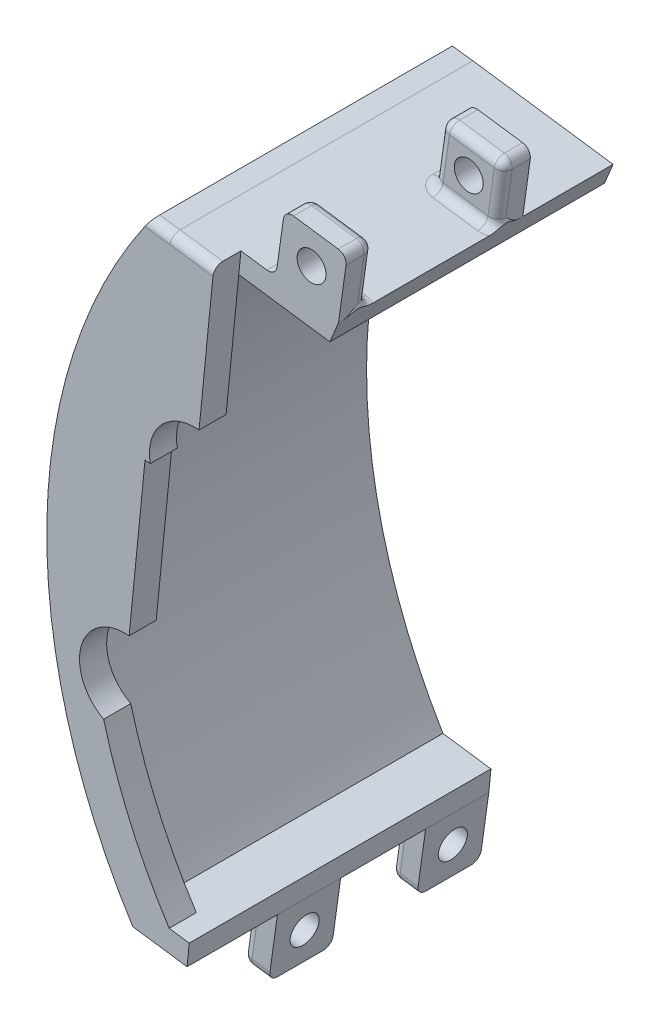
from build123d import *

# Parameters (mm, degrees)
SKETCH1_R                = 4.445
BOSS_EXTRUDE2_DEPTH      = 8.128
BOSS_EXTRUDE3_DEPTH      = 30.48
CUT_EXTRUDE1_START       = -38.608
CUT_EXTRUDE1_OUTLINE_R   = 4.445
CUT_EXTRUDE1_DEPTH       = 38.608
BOSS_EXTRUDE13_DEPTH     = 3.81
BOSS_EXTRUDE14_DEPTH     = 8.128
BOSS_EXTRUDE15_OUTLINE_W = 8.89
BOSS_EXTRUDE15_OUTLINE_H = 3.81
BOSS_EXTRUDE15_DEPTH     = 8.89
SKETCH10_W               = 3.81
SKETCH10_H               = 8.89
BOSS_EXTRUDE16_DEPTH     = 8.89
SKETCH11_R               = 2.032
CUT_EXTRUDE3_DEPTH       = 453.756346398
SKETCH12_R               = 2.032
CUT_EXTRUDE4_DEPTH       = 167.419125065
FILLET1_R                = 1.27
FILLET2_R                = 1.27
FILLET3_R                = 1.27


# Read off the part's stored shape, not the designer's step: Cut-Extrude1, Boss-Extrude15
with BuildPart() as part:
    # Sketch1 → Boss-Extrude2 (new body)
    with BuildSketch(Plane.XY):
        with BuildLine():
            Line((422.721831239, -137.260955008), (397.142573767, -117.628068619))
            Line((397.142573767, -117.628068619), (377.42339183, -114.876256201))
            Line((377.42339183, -114.876256201), (374.540581179, -114.51871973))
            ThreePointArc((374.540581179, -114.51871973), (359.974116362, -157.771470169), (372.030446696, -201.789957384))
            Line((372.030446696, -201.789957384), (375.362354889, -202.25020442))
            Line((375.362354889, -202.25020442), (407.292032563, -206.705991877))
            Line((407.292032563, -206.705991877), (428.301760664, -185.691281663))
            ThreePointArc((428.301760664, -185.691281663), (410.835199313, -163.167091308), (422.721831239, -137.260955008))
        make_face()
        with Locations((413.081283236, -189.895733265)):
            Circle(SKETCH1_R, mode=Mode.SUBTRACT)
        with BuildLine():
            Line((375.438501949, -117.676800355), (395.924761017, -120.535658409))
            Line((395.924761017, -120.535658409), (403.250926595, -126.158721416))
            Line((403.250926595, -126.158721416), (396.525446728, -140.500644454))
            ThreePointArc((396.525446728, -140.500644454), (394.840250533, -144.59682662), (393.557057048, -148.836167256))
            Line((393.557057048, -148.836167256), (408.135947471, -152.492527686))
            ThreePointArc((408.135947471, -152.492527686), (407.478732389, -164.116282679), (411.163311063, -175.160172021))
            Line((411.163311063, -175.160172021), (398.054918567, -182.514290852))
            ThreePointArc((398.054918567, -182.514290852), (404.027476783, -190.830097132), (411.692336104, -197.617881552))
            ThreePointArc((411.692336104, -197.617881552), (411.8058947, -197.693319009), (411.923337289, -197.76255486))
            Line((411.923337289, -197.76255486), (406.209814322, -203.477432695))
            Line((406.209814322, -203.477432695), (373.21862712, -198.873511552))
            ThreePointArc((373.21862712, -198.873511552), (362.510049562, -157.95204405), (375.438501949, -117.676800355))
        make_face(mode=Mode.SUBTRACT)
        with Locations((404.375009271, -140.520000011)):
            Circle(SKETCH1_R, mode=Mode.SUBTRACT)
    extrude(amount=BOSS_EXTRUDE2_DEPTH)


with BuildPart() as body_2:
    # Sketch2 → Boss-Extrude3 (new body)
    with BuildSketch(Plane.XY.offset(8.128)):
        with BuildLine():
            Line((397.142573767, -117.628068619), (377.42339183, -114.876256201))
            Line((377.42339183, -114.876256201), (374.540581179, -114.51871973))
            ThreePointArc((374.540581179, -114.51871973), (359.974116362, -157.771470169), (372.030446696, -201.789957384))
            Line((372.030446696, -201.789957384), (375.362354889, -202.25020442))
            Line((375.362354889, -202.25020442), (407.292032563, -206.705991877))
            Line((407.292032563, -206.705991877), (414.532433241, -199.463874257))
            ThreePointArc((414.532433241, -199.463874257), (409.852770309, -196.253623443), (405.604270928, -192.491282623))
            ThreePointArc((405.604270928, -192.491282623), (405.997230199, -190.639893213), (406.27151817, -188.767241124))
            ThreePointArc((406.27151817, -188.767241124), (395.867947628, -167.427396522), (398.397521154, -143.821793259))
            ThreePointArc((398.397521154, -143.821793259), (398.461114435, -137.105611235), (404.245702044, -133.692446827))
            ThreePointArc((404.245702044, -133.692446827), (407.006708255, -130.47787998), (410.071206758, -127.551201961))
            Line((410.071206758, -127.551201961), (397.142573767, -117.628068619))
        make_face()
        with BuildLine():
            ThreePointArc((403.061727172, -189.725585097), (401.059193553, -196.35778198), (397.415632908, -202.25020442))
            Line((397.415632908, -202.25020442), (373.21862712, -198.873511552))
            ThreePointArc((373.21862712, -198.873511552), (362.510049562, -157.95204405), (375.438501949, -117.676800355))
            Line((375.438501949, -117.676800355), (395.924761017, -120.535658409))
            Line((395.924761017, -120.535658409), (400.202083686, -123.818638382))
            ThreePointArc((400.202083686, -123.818638382), (401.150247915, -126.46196405), (401.831128402, -129.1864067))
            Line((401.831128402, -129.1864067), (400.808060919, -131.368073344))
            ThreePointArc((400.808060919, -131.368073344), (395.439235277, -136.441663908), (395.124115066, -143.821793259))
            ThreePointArc((395.124115066, -143.821793259), (392.848289911, -167.853501069), (403.061727172, -189.725585097))
        make_face(mode=Mode.SUBTRACT)
    extrude(amount=BOSS_EXTRUDE3_DEPTH)


with BuildPart() as cut_extrude1_tool:
    # Cut-Extrude1 outline → Cut-Extrude1 (new body)
    with BuildSketch(Plane.XY.offset(38.608).offset(CUT_EXTRUDE1_START)):
        with BuildLine():
            Line((397.142573767, -117.628068619), (395.924761017, -120.535658409))
            Line((395.924761017, -120.535658409), (400.202083686, -123.818638382))
            ThreePointArc((400.202083686, -123.818638382), (401.150247915, -126.46196405), (401.831128402, -129.1864067))
            Line((401.831128402, -129.1864067), (400.808060919, -131.368073344))
            ThreePointArc((400.808060919, -131.368073344), (395.439235277, -136.441663908), (395.124115066, -143.821793259))
            ThreePointArc((395.124115066, -143.821793259), (394.268902285, -146.306578133), (393.557057048, -148.836167256))
            ThreePointArc((393.557057048, -148.836167256), (392.580609278, -166.105992541), (398.054918568, -182.514290852))
            ThreePointArc((398.054918568, -182.514290852), (400.385798954, -186.239721497), (403.061727172, -189.725585097))
            ThreePointArc((403.061727172, -189.725585097), (401.059193553, -196.35778198), (397.415632908, -202.25020442))
            Line((397.415632908, -202.25020442), (379.967554953, -199.815324629))
            Line((379.967554953, -199.815324629), (379.666531571, -202.850852403))
            Line((379.666531571, -202.850852403), (407.292032563, -206.705991877))
            Line((407.292032563, -206.705991877), (428.301760664, -185.691281663))
            ThreePointArc((428.301760664, -185.691281663), (410.835199313, -163.167091308), (422.721831239, -137.260955008))
            Line((422.721831239, -137.260955008), (397.142573767, -117.628068619))
        make_face()
        with BuildLine():
            Line((411.923337289, -197.76255486), (411.913410508, -197.772483995))
            ThreePointArc((411.913410508, -197.772483995), (411.802759907, -197.695344929), (411.692336104, -197.617881552))
            ThreePointArc((411.692336104, -197.617881552), (411.8058947, -197.693319009), (411.923337289, -197.76255486))
        make_face(mode=Mode.SUBTRACT)
        with BuildLine():
            Line((411.163311063, -175.160172021), (400.71315601, -181.022956652))
            ThreePointArc((400.71315601, -181.022956652), (395.601784353, -165.702501323), (396.513495254, -149.57763683))
            Line((396.513495254, -149.57763683), (408.135947471, -152.492527686))
            ThreePointArc((408.135947471, -152.492527686), (407.478732389, -164.116282679), (411.163311063, -175.160172021))
        make_face(mode=Mode.SUBTRACT)
        with Locations((404.375009271, -140.520000011)):
            Circle(CUT_EXTRUDE1_OUTLINE_R, mode=Mode.SUBTRACT)
        with Locations((413.081283236, -189.895733265)):
            Circle(CUT_EXTRUDE1_OUTLINE_R, mode=Mode.SUBTRACT)
    extrude(amount=CUT_EXTRUDE1_DEPTH)


with BuildPart() as part_1:
    add(part.part)

    # Cut-Extrude1: cut by cut_extrude1_tool
    add(cut_extrude1_tool.part, mode=Mode.SUBTRACT)



with BuildPart() as body_2_1:
    add(body_2.part)

    # Cut-Extrude1: cut by cut_extrude1_tool
    add(cut_extrude1_tool.part, mode=Mode.SUBTRACT)

    # Sketch6 → Boss-Extrude13 (add)
    with BuildSketch(Plane.XY.offset(38.608)):
        with BuildLine():
            Line((377.42339183, -114.876256201), (374.540581179, -114.51871973))
            ThreePointArc((374.540581179, -114.51871973), (359.974116362, -157.771470169), (372.030446696, -201.789957384))
            Line((372.030446696, -201.789957384), (375.362354889, -202.25020442))
            Line((375.362354889, -202.25020442), (379.666531571, -202.850852403))
            Line((379.666531571, -202.850852403), (379.967554953, -199.815324629))
            Line((379.967554953, -199.81532463), (377.148493798, -199.421924563))
            ThreePointArc((377.148493798, -199.421924563), (371.721173342, -189.361206639), (367.93985441, -178.573459905))
            ThreePointArc((367.93985441, -178.573459905), (364.812247711, -171.128372205), (371.521164554, -166.633743264))
            Line((371.521164554, -166.633743264), (373.754119512, -144.116566189))
            Line((373.754119512, -144.116566189), (374.487542914, -144.189297394))
            ThreePointArc((374.487542914, -144.189297394), (376.02820359, -138.703320505), (381.348097321, -136.661676945))
            Line((381.348097321, -136.661676945), (383.425425917, -115.713840234))
            Line((383.425425917, -115.713840234), (377.42339183, -114.876256201))
        make_face()
    extrude(amount=BOSS_EXTRUDE13_DEPTH)


with BuildPart() as part_2:
    add(part_1.part)

    add(body_2_1.part)  # Boss-Extrude14 merges body 2
    # Sketch7 → Boss-Extrude14 (add)
    with BuildSketch(Plane(origin=(0, 0, 8.128), x_dir=(-1, 0, 0), z_dir=(0, 0, -1))):
        with BuildLine():
            Line((-380.886266304, -115.359500436), (-383.425425917, -115.713840234))
            Line((-383.425425917, -115.713840234), (-383.124402536, -118.749368007))
            Line((-383.124402536, -118.749368007), (-378.816626061, -118.148217674))
            ThreePointArc((-378.816626061, -118.148217674), (-379.834773745, -116.741485643), (-380.886266304, -115.359500436))
        make_face()
    extrude(amount=BOSS_EXTRUDE14_DEPTH)

    # Boss-Extrude15 outline → Boss-Extrude15 (add)
    with BuildSketch(Plane(origin=(-8.515136706, -61.018523217, 0), x_dir=(0.9904028421684975, -0.13821074569136185, 0), z_dir=(0.13821074569136185, 0.9904028421684975, 0))):
        with Locations((405.143596883, -36.703)):
            Rectangle(BOSS_EXTRUDE15_OUTLINE_W, BOSS_EXTRUDE15_OUTLINE_H)
        with Locations((405.143596883, -14.605)):
            Rectangle(BOSS_EXTRUDE15_OUTLINE_W, BOSS_EXTRUDE15_OUTLINE_H)
    extrude(amount=BOSS_EXTRUDE15_DEPTH)

    # Sketch10 → Boss-Extrude16 (add)
    with BuildSketch(Plane(origin=(-20.514630148, -147.00555954, 0), x_dir=(0.9904028421684976, -0.1382107456913612, 0), z_dir=(-0.1382107456913612, -0.9904028421684976, 0))):
        with Locations((402.153979519, 25.273)):
            Rectangle(SKETCH10_W, SKETCH10_H)
        with Locations((402.153979519, 4.445)):
            Rectangle(SKETCH10_W, SKETCH10_H)
    extrude(amount=BOSS_EXTRUDE16_DEPTH)

    # Sketch11 → Cut-Extrude3 (cut, through all)
    with BuildSketch(Plane.XY.offset(38.608)):
        with Locations((393.354579898, -112.611381221)):
            Circle(SKETCH11_R)
    extrude(amount=-CUT_EXTRUDE3_DEPTH, mode=Mode.SUBTRACT)

    # Sketch12 → Cut-Extrude4 (cut, through all)
    with BuildSketch(Plane(origin=(400.181161719, -55.845292863, 0), x_dir=(0, 0, -1), z_dir=(0.9904028421684976, -0.13821074569136127, 0))):
        with Locations(Location((-25.273, -152.875066313, 0), (0, 0, 90))):
            Circle(SKETCH12_R)
        with Locations(Location((-4.445, -152.875066313, 0), (0, 0, 90))):
            Circle(SKETCH12_R)
    extrude(amount=-CUT_EXTRUDE4_DEPTH, mode=Mode.SUBTRACT)

    # Fillet1
    fillet1_edges = [part_2.edges().sort_by_distance(p)[0] for p in [
        (374.664403213, -211.128950728, 4.445),
        (375.278749978, -206.726610095, 8.89),
        (375.278749978, -206.726610095, 0),
        (376.551120627, -211.392242199, 0),
        (376.551120627, -211.392242199, 8.89),
        (375.278749978, -206.726610095, 20.828),
        (376.551120627, -211.392242199, 20.828),
        (376.551120627, -211.392242199, 29.718),
        (380.424408874, -115.295048218, 42.418),
        (388.952239265, -111.997034457, 34.798),
        (397.756920532, -113.225727986, 34.798),
        (393.968926663, -108.209040588, 34.798),
        (389.566586029, -107.594693823, 36.703),
        (398.371267296, -108.823387352, 36.703),
        (388.952239265, -111.997034457, 16.51),
        (389.566586029, -107.594693823, 14.605),
        (398.371267296, -108.823387352, 14.605),
        (393.968926663, -108.209040588, 16.51),
        (397.756920532, -113.225727986, 16.51),
        (375.981986505, -114.697487965, 42.418),
    ]]
    fillet(fillet1_edges, radius=FILLET1_R)

    # Fillet2
    # the kernel refuses this fillet: 1.27 mm, written as the material it adds along each edge
    with BuildSketch(Plane(origin=(388.3378925, -116.39937509, 12.7), x_dir=(-0.9904028421685107, 0.13821074569126718, 0), z_dir=(0, 0, 1))) as fillet2_piece_1:
        with BuildLine():
            CenterArc((FILLET2_R, -FILLET2_R), FILLET2_R, 90, 90)
            Line((0, -FILLET2_R), (0, 0))
            Line((0, 0), (FILLET2_R, 0))
        make_face()
    extrude(amount=2.54)
    with BuildSketch(Plane(origin=(388.3378925, -116.39937509, 36.068), x_dir=(0.1382107456913754, 0.9904028421684955, 0), z_dir=(0, 0, 1))) as fillet2_piece_2:
        with BuildLine():
            CenterArc((FILLET2_R, FILLET2_R), FILLET2_R, 180, 90)
            Line((0, FILLET2_R), (0, 0))
            Line((0, 0), (FILLET2_R, 0))
        make_face()
    extrude(amount=2.54)
    with BuildSketch(Plane(origin=(395.884762157, -117.452540972, 34.798), x_dir=(0.13821074569136185, 0.9904028421684975, 0), z_dir=(-0.9904028421684975, 0.13821074569136185, 0))) as fillet2_piece_3:
        with BuildLine():
            CenterArc((FILLET2_R, FILLET2_R), FILLET2_R, 180, 90)
            Line((0, FILLET2_R), (0, 0))
            Line((0, 0), (FILLET2_R, 0))
        make_face()
    extrude(amount=6.35)
    with BuildSketch(Plane(origin=(389.59570411, -116.574902737, 16.51), x_dir=(0, 0, 1), z_dir=(0.9904028421684975, -0.13821074569136185, 0))) as fillet2_piece_4:
        with BuildLine():
            CenterArc((FILLET2_R, -FILLET2_R), FILLET2_R, 90, 90)
            Line((0, -FILLET2_R), (0, 0))
            Line((0, 0), (FILLET2_R, 0))
        make_face()
    extrude(amount=6.35)
    with BuildSketch(Plane(origin=(389.59570411, -116.574902737, 36.068), x_dir=(-0.9904028421684968, 0.13821074569136593, 0), z_dir=(0, 0, 1))) as fillet2_piece_5:
        with BuildLine():
            CenterArc((1.27 + FILLET2_R, -FILLET2_R), FILLET2_R, 90, 90)
            Line((1.27 + FILLET2_R, 0), (1.27, 0))
            Line((1.27, 0), (1.27, -FILLET2_R))
        make_face()
    revolve(axis=Axis((389.59570411, -116.574902737, 36.068), (-0.13821074569136182, -0.9904028421684975, 0)), revolution_arc=90)
    with BuildSketch(Plane(origin=(395.884762157, -117.452540972, 36.068), x_dir=(-0.7940497732926407, 0.11080966916708068, 0.597667277632788), z_dir=(-0.5919313704386218, 0.08260404011695381, -0.8017442392976778))) as fillet2_piece_6_section:
        with BuildLine():
            CenterArc((1.27 + FILLET2_R, FILLET2_R), FILLET2_R, 180, 90)
            Line((1.27 + FILLET2_R, 0), (1.27, 0))
            Line((1.27, 0), (1.27, FILLET2_R))
        make_face()
    fillet2_piece_6 = revolve(axis=Axis((395.884762157, -117.452540972, 36.068), (0.13821074569136182, 0.9904028421684975, 0)), revolution_arc=233.296989237, mode=Mode.PRIVATE)
    fillet2_piece_6 = split(fillet2_piece_6, bisect_by=Plane(origin=(397.316474441, -117.212871927, 36.083951898), z_dir=(-0.9223638930566347, 0.3863222085065898, 0)), keep=Keep.TOP, mode=Mode.PRIVATE)
    add(fillet2_piece_6)
    with BuildSketch(Plane(origin=(389.59570411, -116.574902737, 15.24), x_dir=(0, 0, 1), z_dir=(0.9904028421684975, -0.13821074569136182, 0))) as fillet2_piece_7:
        with BuildLine():
            CenterArc((1.27 + FILLET2_R, -FILLET2_R), FILLET2_R, 90, 90)
            Line((1.27, -FILLET2_R), (1.27, 0))
            Line((1.27, 0), (1.27 + FILLET2_R, 0))
        make_face()
    revolve(axis=Axis((389.59570411, -116.574902737, 15.24), (-0.13821074569136182, -0.9904028421684975, 0)), revolution_arc=90)
    with BuildSketch(Plane(origin=(395.884762157, -117.452540972, 15.24), x_dir=(-0.79404977329264, 0.11080966916708059, -0.5976672776327889), z_dir=(-0.5919313704386227, 0.08260404011695394, 0.8017442392976771))) as fillet2_piece_8_section:
        with BuildLine():
            CenterArc((1.27 + FILLET2_R, -FILLET2_R), FILLET2_R, 90, 90)
            Line((1.27, -FILLET2_R), (1.27, 0))
            Line((1.27, 0), (1.27 + FILLET2_R, 0))
        make_face()
    fillet2_piece_8 = revolve(axis=Axis((395.884762157, -117.452540972, 15.24), (-0.13821074569136182, -0.9904028421684975, 0)), revolution_arc=233.296989237, mode=Mode.PRIVATE)
    fillet2_piece_8 = split(fillet2_piece_8, bisect_by=Plane(origin=(397.316474722, -117.212871258, 15.224053427), z_dir=(-0.9223638930566347, 0.3863222085065898, 0)), keep=Keep.TOP, mode=Mode.PRIVATE)
    add(fillet2_piece_8)

    # Fillet3
    # the kernel refuses this fillet: 1.27 mm, written as the material it takes off along each edge
    with BuildSketch(Plane(origin=(376.09774247, -210.046666766, 22.098), x_dir=(-0.1382107456913612, -0.9904028421684976, 0), z_dir=(-0.9904028421684976, 0.1382107456913612, 0))) as fillet3_piece_1_section:
        Polygon((0, 0), (FILLET3_R, 0), (FILLET3_R, -FILLET3_R), (0, -FILLET3_R), align=None)
    fillet3_piece_1 = extrude(amount=FILLET3_R, mode=Mode.PRIVATE)
    fillet3_piece_1 = fillet3_piece_1 - Plane(origin=(376.09774247, -210.046666766, 22.098), x_dir=(0.0977297555112109, 0.7003205658037746, 0.7071067811865475), z_dir=(-0.9904028421684976, 0.1382107456913612, 0)) * Sphere(FILLET3_R, mode=Mode.PRIVATE)
    add(fillet3_piece_1, mode=Mode.SUBTRACT)
    with BuildSketch(Plane(origin=(374.664403213, -211.128950728, 28.448), x_dir=(0.13821074569137695, 0.9904028421684954, 0), z_dir=(0, 0, -1))) as fillet3_piece_2:
        with BuildLine():
            CenterArc((FILLET3_R, FILLET3_R), FILLET3_R, 180, 90)
            Line((0, FILLET3_R), (0, 0))
            Line((0, 0), (FILLET3_R, 0))
        make_face()
    extrude(amount=6.35, mode=Mode.SUBTRACT)
    with BuildSketch(Plane(origin=(375.893096742, -202.324269462, 29.718), x_dir=(0, 0, -1), z_dir=(-0.1382107456913612, -0.9904028421684976, 0))) as fillet3_piece_3:
        with BuildLine():
            CenterArc((FILLET3_R, FILLET3_R), FILLET3_R, 180, 90)
            Line((0, FILLET3_R), (0, 0))
            Line((0, 0), (FILLET3_R, 0))
        make_face()
    extrude(amount=7.62, mode=Mode.SUBTRACT)
    with BuildSketch(Plane(origin=(374.83993086, -209.871139119, 28.448), x_dir=(0, 0, 1), z_dir=(0.1382107456913612, 0.9904028421684976, 0))) as fillet3_piece_4:
        with BuildLine():
            CenterArc((1.27 - FILLET3_R, FILLET3_R), FILLET3_R, 270, 90)
            Line((1.27, FILLET3_R), (1.27, 0))
            Line((1.27, 0), (1.27 - FILLET3_R, 0))
        make_face()
    revolve(axis=Axis((374.83993086, -209.871139119, 28.448), (0.9904028421684976, -0.1382107456913612, 0)), revolution_arc=90, mode=Mode.SUBTRACT)


solid = part_2.part
